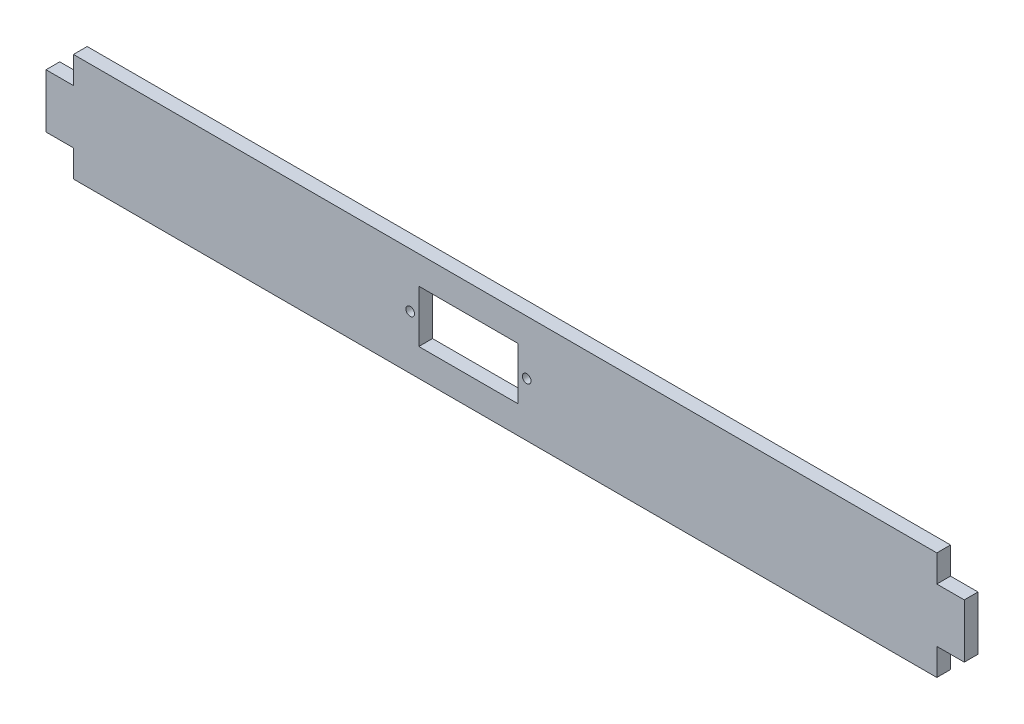
from build123d import *

# Parameters (mm, degrees)
SKETCH2_W           = 200
SKETCH2_H           = 25
BOSS_EXTRUDE1_DEPTH = 1.59
SKETCH4_R           = 1
SKETCH4_W           = 23
SKETCH4_H           = 12.1
CUT_EXTRUDE1_DEPTH  = 3.18
SKETCH5_W           = 6.36
SKETCH5_H           = 12.5
BOSS_EXTRUDE2_DEPTH = 3.18


with BuildPart() as part:
    # Sketch2 → Boss-Extrude1 (new, symmetric)
    with BuildSketch(Plane.XY):
        with Locations((100, 12.5)):
            Rectangle(SKETCH2_W, SKETCH2_H)
    extrude(amount=BOSS_EXTRUDE1_DEPTH, both=True)

    # Sketch4 → Cut-Extrude1 (cut)
    with BuildSketch(Plane(origin=(0, 0, -1.59), x_dir=(-1, 0, 0), z_dir=(0, 0, -1))):
        with Locations((-105, 12.457546073)):
            Circle(SKETCH4_R)
        with Locations((-78, 12.457546073)):
            Circle(SKETCH4_R)
        with Locations((-91.5, 12.457546073)):
            Rectangle(SKETCH4_W, SKETCH4_H)
    extrude(amount=-CUT_EXTRUDE1_DEPTH, mode=Mode.SUBTRACT)

    # Sketch5 → Boss-Extrude2 (add)
    with BuildSketch(Plane(origin=(0, 0, -1.59), x_dir=(-1, 0, 0), z_dir=(0, 0, -1))):
        with Locations((-203.18, 12.5)):
            Rectangle(SKETCH5_W, SKETCH5_H)
        with Locations((3.18, 12.5)):
            Rectangle(SKETCH5_W, SKETCH5_H)
    extrude(amount=-BOSS_EXTRUDE2_DEPTH)


solid = part.part
